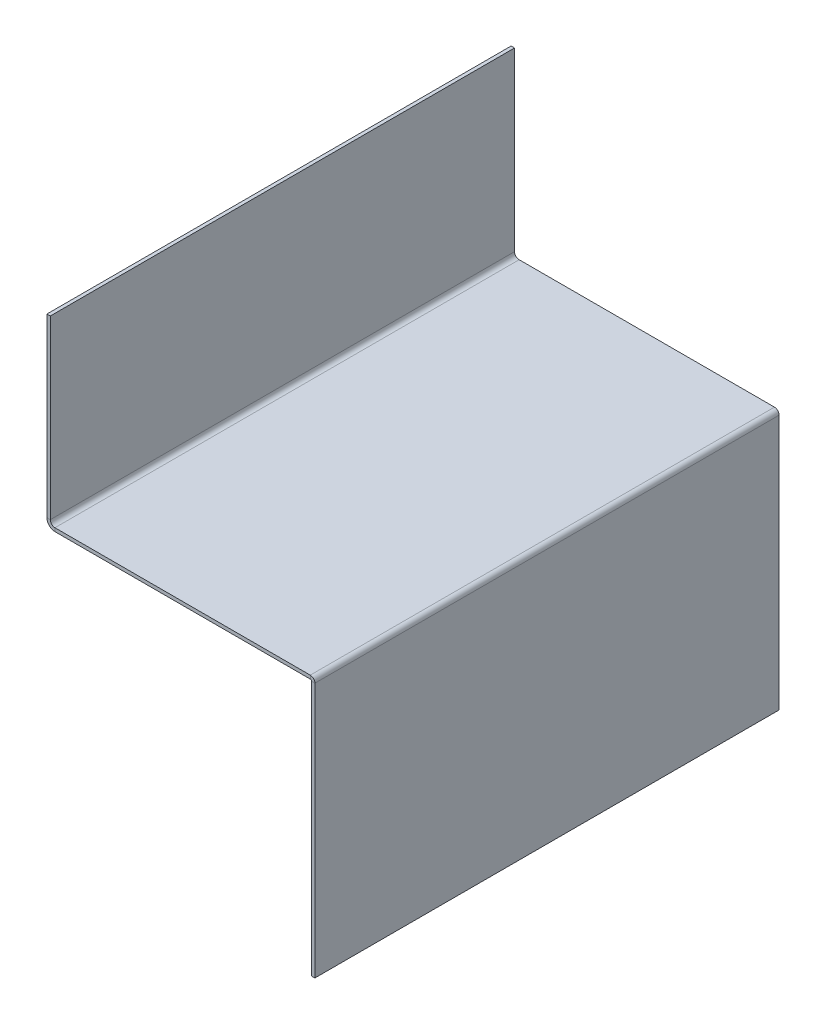
from build123d import *

# Parameters (mm, degrees)
SM_BASE_FLANGE_1_DEPTH = 50


# Sheet-metal steps are written as plain solids
with BuildPart() as part:
    # Sketch 1 → 基体-法兰1 (new, symmetric)
    with BuildSketch(Plane.XY):
        with BuildLine():
            Line((0, 39), (0, 1))
            ThreePointArc((0, 1), (0.292893219, 0.292893219), (1, 0))
            Line((1, 0), (56, 0))
            ThreePointArc((56, 0), (56.707106781, -0.292893219), (57, -1))
            Line((57, -1), (57, -56))
            Line((57, -56), (56.2634, -56))
            Line((56.2634, -56), (56.2634, -1))
            ThreePointArc((56.2634, -1), (56.186251926, -0.813748074), (56, -0.7366))
            Line((56, -0.7366), (1, -0.7366))
            ThreePointArc((1, -0.7366), (-0.227961636, -0.227961636), (-0.7366, 1))
            Line((-0.7366, 1), (-0.7366, 39))
            Line((-0.7366, 39), (0, 39))
        make_face()
    extrude(amount=SM_BASE_FLANGE_1_DEPTH, both=True)


solid = part.part
